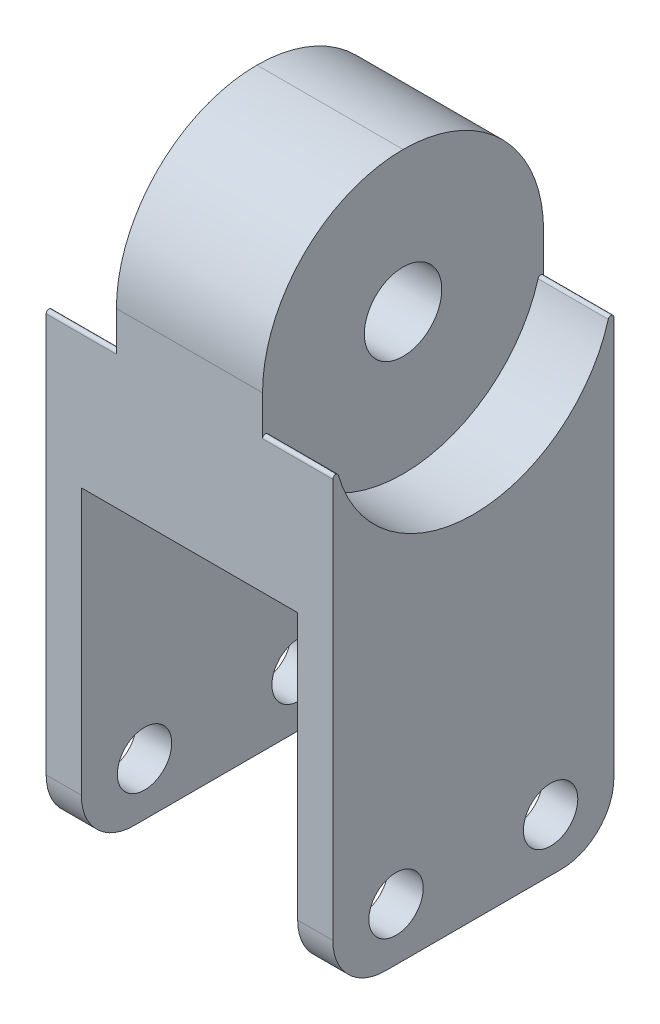
from build123d import *

# Parameters (mm, degrees)
BOSS_EXTRUDE4_DEPTH   = 12.7
F_8_CLEARANCE_HOLE1_D = 4.9149
FILLET2_R             = 4.7625
FILLET3_R             = 12.7
M6_CLEARANCE_HOLE2_D  = 7
BOSS_EXTRUDE5_START   = -19.558
BOSS_EXTRUDE5_DEPTH   = 25.908
CUT_EXTRUDE1_START    = -6.35
CUT_EXTRUDE1_DEPTH    = 6.35
CUT_EXTRUDE2_START    = -25.908
CUT_EXTRUDE2_DEPTH    = 6.35


with BuildPart() as part:
    # Sketch7 → Boss-Extrude4 (new, symmetric)
    with BuildSketch(Plane.XY):
        Polygon((-12.954, -19.05), (-12.954, 12.954), (-6.604, 12.954), (-6.604, 38.1), (6.604, 38.1), (6.604, 12.954), (12.954, 12.954), (12.954, -19.05), (9.779, -19.05), (9.779, 9.779), (-9.779, 9.779), (-9.779, -19.05), align=None)
    extrude(amount=BOSS_EXTRUDE4_DEPTH, both=True)

    # #8 Clearance Hole1 (through all)
    with Locations(Plane(origin=(12.954, 0, 0), x_dir=(0, 0, -1), z_dir=(1, 0, 0))):
        with Locations((-6.985, -14.2875), (6.985, -14.2875)):
            Hole(F_8_CLEARANCE_HOLE1_D / 2)

    # Fillet2
    fillet2_edges = [part.edges().sort_by_distance(p)[0] for p in [
        (11.3665, -19.05, -12.7),
        (-11.3665, -19.05, -12.7),
        (-11.3665, -19.05, 12.7),
        (11.3665, -19.05, 12.7),
    ]]
    fillet(fillet2_edges, radius=FILLET2_R)

    # Fillet3
    fillet3_edges = [part.edges().sort_by_distance(p)[0] for p in [
        (0, 38.1, 12.7),
        (0, 38.1, -12.7),
    ]]
    fillet(fillet3_edges, radius=FILLET3_R - 0.0001)  # a hair under: the kernel refuses the full size

    # M6 Clearance Hole2 (through all)
    with Locations(Plane(origin=(-6.604, 0, 0), x_dir=(0, 0, -1), z_dir=(-1, 0, 0))):
        with Locations((0, -25.4)):
            Hole(M6_CLEARANCE_HOLE2_D / 2)

    # Sketch12 → Boss-Extrude5 (add)
    with BuildSketch(Plane(origin=(6.604, 0, 0), x_dir=(0, 0, -1), z_dir=(1, 0, 0)).offset(BOSS_EXTRUDE5_START)):
        with BuildLine():
            Line((-12.7, 12.954), (-12.7, 21.807897552))
            ThreePointArc((-12.7, 21.807897552), (-12.481567114, 22.059395027), (-12.201960784, 21.878330933))
            ThreePointArc((-12.201960784, 21.878330933), (-8.610950381, 16.065037036), (-2.52726809, 12.954))
            Line((-2.52726809, 12.954), (-12.7, 12.954))
        make_face()
        with BuildLine():
            Line((12.7, 12.954), (12.7, 21.807897552))
            ThreePointArc((12.7, 21.807897552), (12.481567114, 22.059395027), (12.201960784, 21.878330933))
            ThreePointArc((12.201960784, 21.878330933), (8.610950381, 16.065037036), (2.52726809, 12.954))
            Line((2.52726809, 12.954), (12.7, 12.954))
        make_face()
    extrude(amount=BOSS_EXTRUDE5_DEPTH)

    # Sketch13 → Cut-Extrude1 (cut)
    with BuildSketch(Plane(origin=(12.954, 0, 0), x_dir=(0, 0, -1), z_dir=(1, 0, 0)).offset(CUT_EXTRUDE1_START)):
        with BuildLine():
            Line((-2.52726809, 12.954), (2.52726809, 12.954))
            ThreePointArc((2.52726809, 12.954), (0, 12.7), (-2.52726809, 12.954))
        make_face()
    extrude(amount=CUT_EXTRUDE1_DEPTH, mode=Mode.SUBTRACT)

    # Sketch13<2> → Cut-Extrude2 (cut)
    with BuildSketch(Plane(origin=(12.954, 0, 0), x_dir=(0, 0, -1), z_dir=(1, 0, 0)).offset(CUT_EXTRUDE2_START)):
        with BuildLine():
            Line((-2.52726809, 12.954), (2.52726809, 12.954))
            ThreePointArc((2.52726809, 12.954), (0, 12.7), (-2.52726809, 12.954))
        make_face()
    extrude(amount=CUT_EXTRUDE2_DEPTH, mode=Mode.SUBTRACT)


solid = part.part
